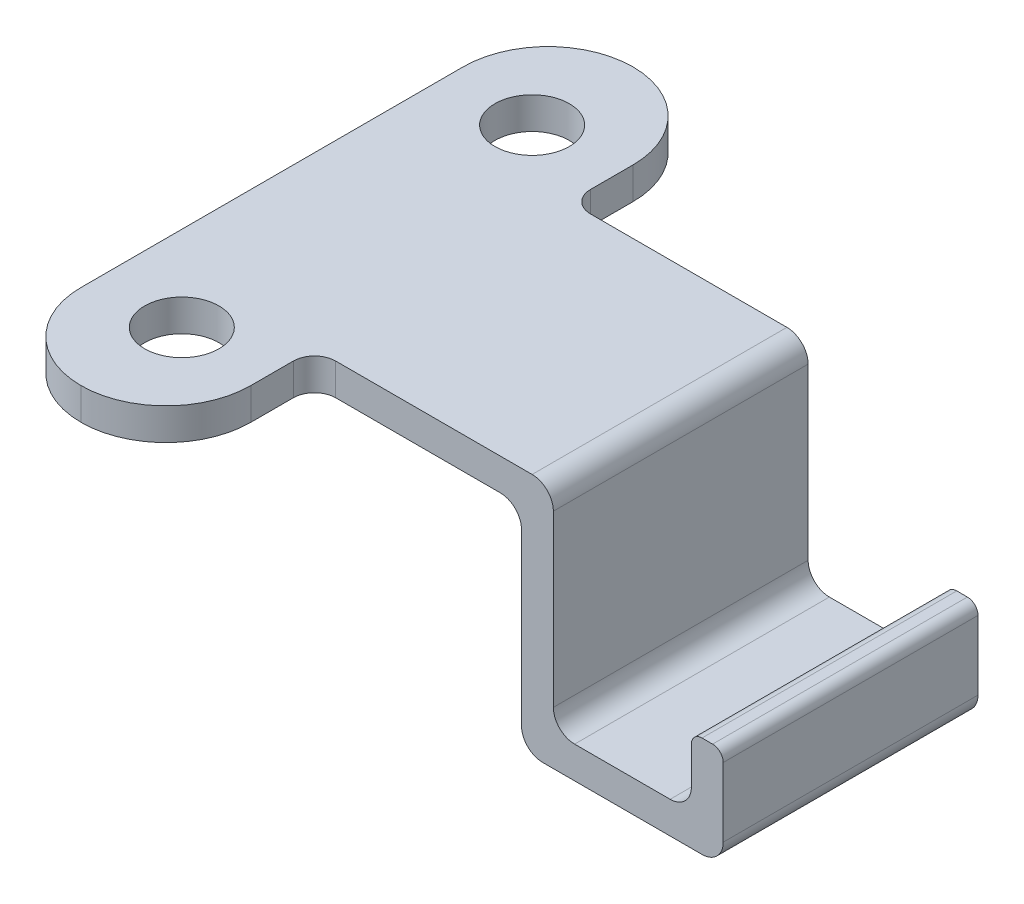
from build123d import *

# Parameters (mm, degrees)
EXTRUDE_1_DEPTH     = 13
SKETCH_2_W          = 19.25
SKETCH_2_H          = 7
CUT_EXTRUDE_1_DEPTH = 16
SKETCH_3_R          = 1.75
CUT_EXTRUDE_2_DEPTH = 6
FILLET_1_R          = 4
FILLET_2_R          = 1
FILLET_3_R          = 1
FILLET_4_R          = 0.5


with BuildPart() as part:
    # 草图1 → 凸台-拉伸1 (new, symmetric)
    with BuildSketch(Plane.XY):
        Polygon((0, -0.75), (17.75, -0.75), (17.75, -10.75), (27.25, -10.75), (27.25, -6), (25.75, -6), (25.75, -9.25), (19.25, -9.25), (19.25, 0.75), (0, 0.75), align=None)
    extrude(amount=EXTRUDE_1_DEPTH, both=True)

    # 草图2 → 切除-拉伸1 (cut)
    with BuildSketch(Plane(origin=(0, 0.75, 0), x_dir=(1, 0, 0), z_dir=(0, 1, 0))):
        with Locations((17.625, 9.5)):
            Rectangle(SKETCH_2_W, SKETCH_2_H)
        with Locations((17.625, -9.5)):
            Rectangle(SKETCH_2_W, SKETCH_2_H)
    extrude(amount=-CUT_EXTRUDE_1_DEPTH, mode=Mode.SUBTRACT)

    # 草图3 → 切除-拉伸2 (cut)
    with BuildSketch(Plane(origin=(0, 0.75, 0), x_dir=(1, 0, 0), z_dir=(0, 1, 0))):
        with Locations(Location((4, 8.25, 0), (0, 0, 270))):
            Circle(SKETCH_3_R)
        with Locations(Location((4, -8.25, 0), (0, 0, 270))):
            Circle(SKETCH_3_R)
    extrude(amount=-CUT_EXTRUDE_2_DEPTH, mode=Mode.SUBTRACT)

    # 圆角1
    fillet_1_edges = [part.edges().sort_by_distance(p)[0] for p in [
        (8, 0, 13),
        (0, 0, 13),
        (0, 0, -13),
        (8, 0, -13),
    ]]
    fillet(fillet_1_edges, radius=FILLET_1_R - 0.0001)  # a hair under: the kernel refuses the full size

    # 圆角2
    fillet_2_edges = [part.edges().sort_by_distance(p)[0] for p in [
        (8, 0, -6),
        (8, 0, 6),
    ]]
    fillet(fillet_2_edges, radius=FILLET_2_R)

    # 圆角3
    fillet_3_edges = [part.edges().sort_by_distance(p)[0] for p in [
        (19.25, 0.75, 0),
        (19.25, -9.25, 0),
        (25.75, -9.25, 0),
        (27.25, -10.75, 0),
        (17.75, -10.75, 0),
        (17.75, -0.75, 0),
    ]]
    fillet(fillet_3_edges, radius=FILLET_3_R)

    # 圆角4
    fillet_4_edges = [part.edges().sort_by_distance(p)[0] for p in [
        (25.75, -6, 0),
        (27.25, -6, 0),
    ]]
    fillet(fillet_4_edges, radius=FILLET_4_R)


solid = part.part
